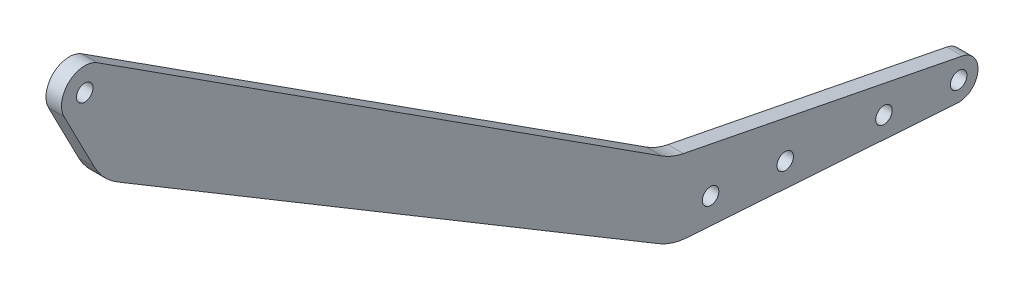
from build123d import *

# Parameters (mm, degrees)
SKETCH1_R           = 3.3782
BOSS_EXTRUDE1_DEPTH = 3.175
FILLET1_R           = 25.4


with BuildPart() as part:
    # Sketch1 → Boss-Extrude1 (new, symmetric)
    with BuildSketch(Plane(origin=(-76.913317281, 0, 0), x_dir=(0, 0, -1), z_dir=(1, 0, 0))):
        with BuildLine():
            Line((535.218804975, 907.961983625), (418.2911251, 916.04381761))
            Line((418.2911251, 916.04381761), (184.951401043, 1055.750632131))
            Line((184.951401043, 1055.750632131), (169.332572934, 1086.068584812))
            ThreePointArc((169.332572934, 1086.068584812), (171.394960666, 1097.480629658), (182.951934738, 1098.442170633))
            Line((182.951934738, 1098.442170633), (418.2911251, 947.10209485))
            Line((418.2911251, 947.10209485), (537.29962452, 923.668549005))
            ThreePointArc((537.29962452, 923.668549005), (543.634872549, 914.838132707), (535.218804975, 907.961983625))
        make_face()
        with Locations((177.8, 1090.430729224)):
            Circle(SKETCH1_R, mode=Mode.SUBTRACT)
        with Locations((434.1661251, 925.56881761)):
            Circle(SKETCH1_R, mode=Mode.SUBTRACT)
        with Locations((535.7661251, 915.880591264)):
            Circle(SKETCH1_R, mode=Mode.SUBTRACT)
        with Locations((464.714426144, 922.655836753)):
            Circle(SKETCH1_R, mode=Mode.SUBTRACT)
        with Locations((505.170909535, 918.798045727)):
            Circle(SKETCH1_R, mode=Mode.SUBTRACT)
    extrude(amount=BOSS_EXTRUDE1_DEPTH, both=True)

    # Fillet1
    fillet1_edges = [part.edges().sort_by_distance(p)[0] for p in [
        (-76.913317281, 1055.750632131, -184.951401043),
        (-76.913317281, 947.10209485, -418.2911251),
        (-76.913317281, 916.04381761, -418.2911251),
    ]]
    fillet(fillet1_edges, radius=FILLET1_R)


solid = part.part
